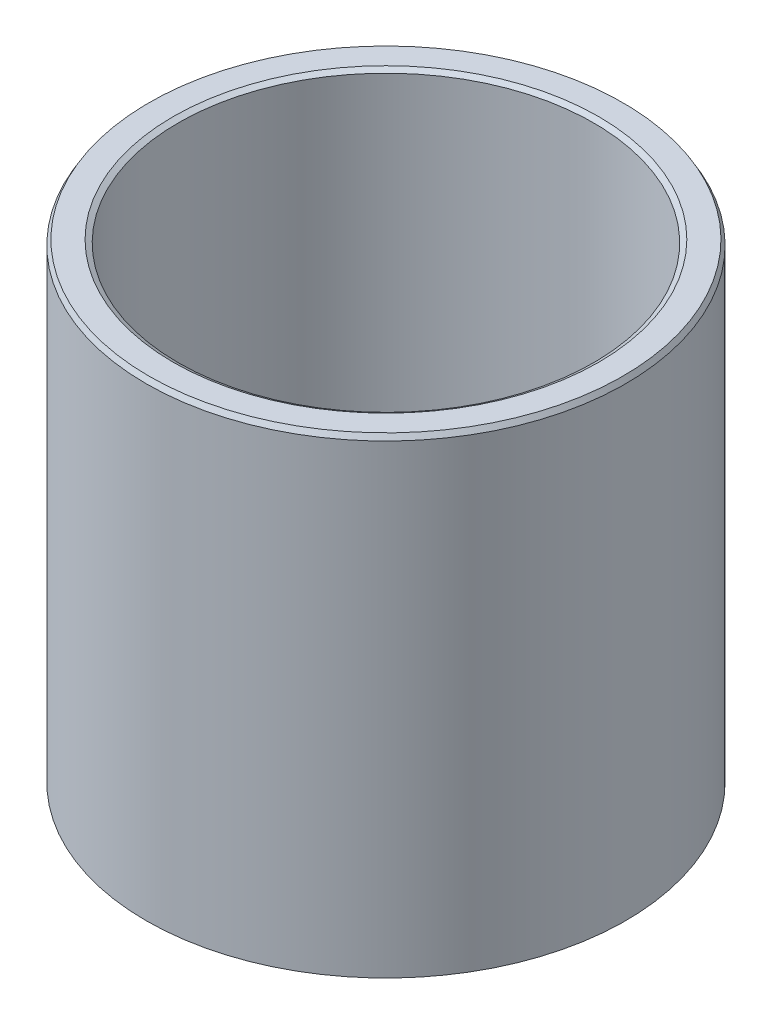
from build123d import *
from OCP.BRepFilletAPI import BRepFilletAPI_MakeChamfer

# Parameters (mm, degrees)
SKETCH1_R           = 57.5
BOSS_EXTRUDE1_DEPTH = 113.411064547
SKETCH2_R           = 49.80621263
CUT_EXTRUDE1_DEPTH  = 140.551315156
CHAMFER1_SIZE       = 1.208390471
CHAMFER1_SIZE2      = 0.697664564


with BuildPart() as part:
    # Sketch1 → Boss-Extrude1 (new body)
    with BuildSketch(Plane(origin=(0, 0, 0), x_dir=(1, 0, 0), z_dir=(0, 1, 0))):
        Circle(SKETCH1_R)
    extrude(amount=BOSS_EXTRUDE1_DEPTH)

    # Sketch2 → Cut-Extrude1 (cut, through all)
    with BuildSketch(Plane(origin=(0, 0, 0), x_dir=(1, 0, 0), z_dir=(0, 1, 0))):
        Circle(SKETCH2_R)
    extrude(amount=CUT_EXTRUDE1_DEPTH, mode=Mode.SUBTRACT)

    # Chamfer1: one chamfer whose edges measure the first distance from different faces: ONE call of the kernel's chamfer builder (chamfer() names one face for all edges)
    chamfer1_edges_1 = [part.edges().sort_by_distance(p)[0] for p in [
        (-49.80621263, 113.411064547, 0),
    ]]
    chamfer1_side_1 = [part.faces().sort_by_distance(p)[0] for p in [
        (-55.873654403, 113.411064547, 0),
    ]]
    chamfer1_edges_2 = [part.edges().sort_by_distance(p)[0] for p in [
        (-49.80621263, 0, 0),
    ]]
    chamfer1_side_2 = [part.faces().sort_by_distance(p)[0] for p in [
        (-49.80621263, 56.705532274, 0),
    ]]
    chamfer1_edges_3 = [part.edges().sort_by_distance(p)[0] for p in [
        (-57.5, 0, 0),
    ]]
    chamfer1_side_3 = [part.faces().sort_by_distance(p)[0] for p in [
        (-55.873654403, 0, 0),
    ]]
    chamfer1_edges_4 = [part.edges().sort_by_distance(p)[0] for p in [
        (-57.5, 113.411064547, 0),
    ]]
    chamfer1_side_4 = [part.faces().sort_by_distance(p)[0] for p in [
        (-57.5, 56.705532274, 0),
    ]]
    chamfer1 = BRepFilletAPI_MakeChamfer(part.part.solid().wrapped)
    for e in chamfer1_edges_1:
        chamfer1.Add(CHAMFER1_SIZE, CHAMFER1_SIZE2, e.wrapped, chamfer1_side_1[0].wrapped)  # the first distance lies on this face
    for e in chamfer1_edges_2:
        chamfer1.Add(CHAMFER1_SIZE, CHAMFER1_SIZE2, e.wrapped, chamfer1_side_2[0].wrapped)  # the first distance lies on this face
    for e in chamfer1_edges_3:
        chamfer1.Add(CHAMFER1_SIZE, CHAMFER1_SIZE2, e.wrapped, chamfer1_side_3[0].wrapped)  # the first distance lies on this face
    for e in chamfer1_edges_4:
        chamfer1.Add(CHAMFER1_SIZE, CHAMFER1_SIZE2, e.wrapped, chamfer1_side_4[0].wrapped)  # the first distance lies on this face
    add(Compound.cast(chamfer1.Shape()), mode=Mode.REPLACE)


solid = part.part
